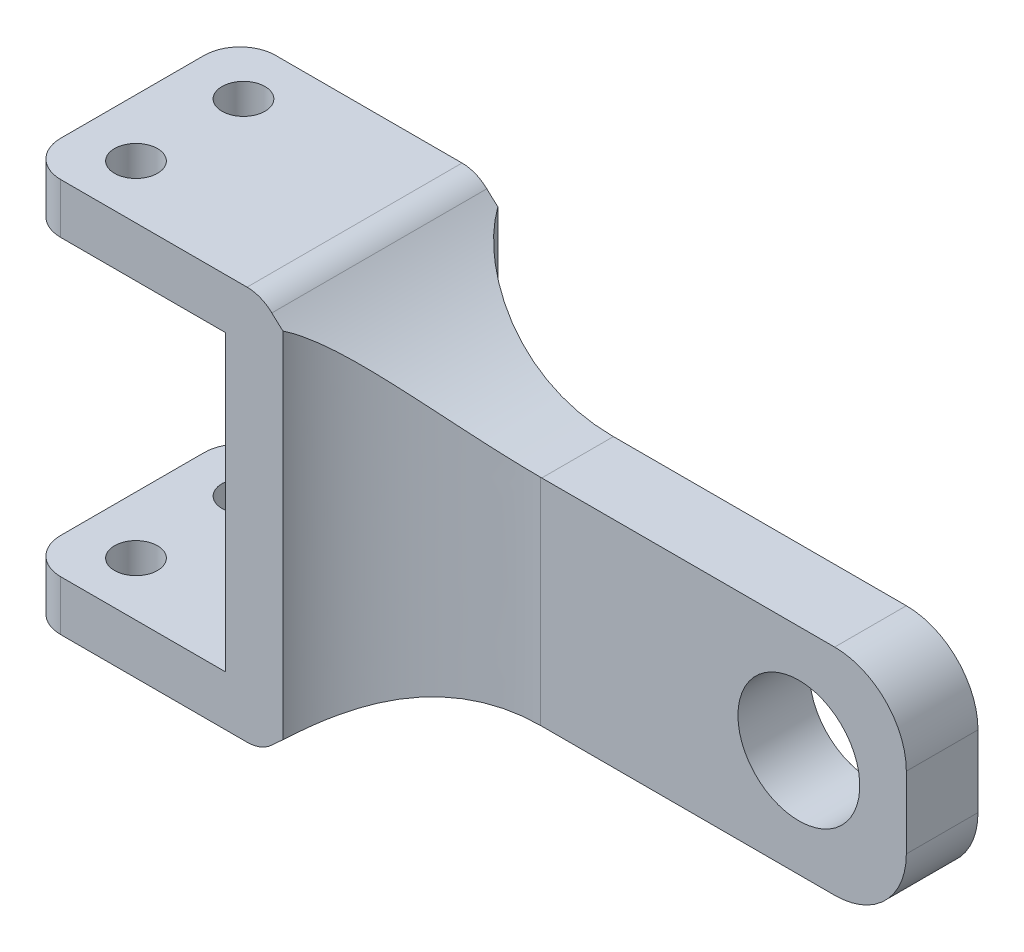
from build123d import *
from build123d.topology import SkipClean

# Parameters (mm, degrees)
SKETCH_1_W             = 85
SKETCH_1_H             = 30
EXTRUDE_1_DEPTH        = 10
EXTRUDE_2_DEPTH        = 10
EXTRUDE_2_DEPTH_BACK   = 20
SKETCH_3_W             = 8
SKETCH_3_H             = 30
SKETCH_2_R             = 8.5
CUT_EXTRUDE_1_DEPTH    = 10
SKETCH_5_W             = 8
SKETCH_5_H             = 30
EXTRUDE_3_DEPTH        = 12.5
SKETCH_6_W             = 30
SKETCH_6_H             = 7
EXTRUDE_4_DEPTH        = 28
CUT_EXTRUDE_2_REACH    = 99.115
SKETCH_7_R             = 3
FILLET_1_R             = 5
FILLET_1_OF_MIRROR_1_R = 5
FILLET_2_DEPTH         = 30
FILLET_3_DEPTH         = 30
FILLET_4_DEPTH         = 10
FILLET_START           = -9.709779072
FILLET_4_2_DEPTH       = 49.419558144
FILLET_START_2         = -11
FILLET_4_3_DEPTH       = 32
FILLET_START_3         = -10
FILLET_4_4_DEPTH       = 30
FILLET_6_R             = 10


with BuildPart() as part:
    # 草图1 → 凸台-拉伸1 (new body)
    with BuildSketch(Plane.XY):
        with Locations((42.5, 15)):
            Rectangle(SKETCH_1_W, SKETCH_1_H)
    extrude(amount=EXTRUDE_1_DEPTH)

    # 草图2 → 切除-拉伸1 (cut)
    with BuildSketch(Plane(origin=(0, 0, 0), x_dir=(-1, 0, 0), z_dir=(0, 0, -1))):
        with Locations((-70, 15)):
            Circle(SKETCH_2_R)
    extrude(amount=-CUT_EXTRUDE_1_DEPTH, mode=Mode.SUBTRACT)



with BuildPart() as body_2:
    # 草图3 → 凸台-拉伸2 (new, two sides: drawn at the far end of the back side and taken through both)
    with BuildSketch(Plane.XY.offset(10).offset(-EXTRUDE_2_DEPTH_BACK)):
        with Locations((4, 15)):
            Rectangle(SKETCH_3_W, SKETCH_3_H)
    extrude(amount=EXTRUDE_2_DEPTH + EXTRUDE_2_DEPTH_BACK)


with BuildPart() as part_1:
    add(part.part)

    add(body_2.part)  # 凸台-拉伸3 merges body 2
    # 草图5 → 凸台-拉伸3 (add)
    with BuildSketch(Plane(origin=(0, 30, 0), x_dir=(1, 0, 0), z_dir=(0, 1, 0))):
        with Locations((4, -5)):
            Rectangle(SKETCH_5_W, SKETCH_5_H)
    extrude_3 = extrude(amount=EXTRUDE_3_DEPTH)

    # 草图6 → 凸台-拉伸4 (add)
    with BuildSketch(Plane.ZY):
        with Locations((5, 39)):
            Rectangle(SKETCH_6_W, SKETCH_6_H)
    extrude_4 = extrude(amount=EXTRUDE_4_DEPTH)

    # 草图7 → 切除-拉伸2 (cut, up to next)
    with BuildSketch(Plane(origin=(0, 42.5, 0), x_dir=(1, 0, 0), z_dir=(0, 1, 0)), mode=Mode.PRIVATE) as cut_extrude_2_sk1:
        with Locations(Location((-20, 2.5, 0), (0, 0, 270))):
            Circle(SKETCH_7_R)
    cut_extrude_2_tool1 = extrude(cut_extrude_2_sk1.sketch, amount=-CUT_EXTRUDE_2_REACH, mode=Mode.PRIVATE) & part_1.part
    # 草图7 → 切除-拉伸2 (cut, up to next)
    with BuildSketch(Plane(origin=(0, 42.5, 0), x_dir=(1, 0, 0), z_dir=(0, 1, 0)), mode=Mode.PRIVATE) as cut_extrude_2_sk2:
        with Locations(Location((-20, -12.5, 0), (0, 0, 270))):
            Circle(SKETCH_7_R)
    cut_extrude_2_tool2 = extrude(cut_extrude_2_sk2.sketch, amount=-CUT_EXTRUDE_2_REACH, mode=Mode.PRIVATE) & part_1.part
    cut_extrude_2_1 = cut_extrude_2_tool1.solids().sort_by_distance((-20, 42.5, -2.5))[0]
    add(cut_extrude_2_1, mode=Mode.SUBTRACT)
    cut_extrude_2_2 = cut_extrude_2_tool2.solids().sort_by_distance((-20, 42.5, 12.5))[0]
    add(cut_extrude_2_2, mode=Mode.SUBTRACT)
    cut_extrude_2 = cut_extrude_2_1 + cut_extrude_2_2  # 切除-拉伸2 as one shape, for the pattern or mirror that repeats it

    # 圆角1
    fillet_1_edges = [part_1.edges().sort_by_distance(p)[0] for p in [
        (8, 42.5, 5),
        (-28, 39, -10),
        (-28, 39, 20),
    ]]
    fillet(fillet_1_edges, radius=FILLET_1_R)

    # 镜向1: 凸台-拉伸3, 凸台-拉伸4, 切除-拉伸2 across plane
    add(extrude_3.mirror(Plane.ZX.offset(15)))
    add(extrude_4.mirror(Plane.ZX.offset(15)))
    add(cut_extrude_2.mirror(Plane.ZX.offset(15)), mode=Mode.SUBTRACT)

    # 圆角1 of 镜向1
    fillet_1_of_mirror_1_edges = [part_1.edges().sort_by_distance(p)[0] for p in [
        (8, -12.5, 5),
        (-28, -9, -10),
        (-28, -9, 20),
    ]]
    fillet(fillet_1_of_mirror_1_edges, radius=FILLET_1_OF_MIRROR_1_R)

    # 圆角2: read off the stored shape, not the designer's step
    # 圆角2 outline → 圆角2 (add)
    with BuildSketch(Plane(origin=(0, 0, 0), x_dir=(1, 0, 0), z_dir=(0, 1, 0))):
        with BuildLine():
            add(Edge.make_bspline(
                [(33.980762114, -10), (13.773502692, -10), (8, -20)],
                knots=[0, 0, 0, 1, 1, 1], degree=2, weights=[1, 0.866025404, 1]))
            Line((33.980762114, -10), (8, -10))
            Line((8, -10), (8, -20))
        make_face()
    extrude(amount=FILLET_2_DEPTH)

    # 圆角3: read off the stored shape, not the designer's step
    # 圆角3 outline → 圆角3 (add)
    with BuildSketch(Plane(origin=(0, 0, 0), x_dir=(1, 0, 0), z_dir=(0, 1, 0))):
        with BuildLine():
            Line((8, 0), (33.980762114, 0))
            add(Edge.make_bspline(
                [(33.980762114, 0), (13.773502692, 0), (8, 10)],
                knots=[0, 0, 0, 1, 1, 1], degree=2, weights=[1, 0.866025404, 1]))
            Line((8, 10), (8, 0))
        make_face()
    extrude(amount=FILLET_3_DEPTH)

    # 圆角4: read off the stored shape, not the designer's step
    # 圆角4 outline → 圆角4 (add)
    with BuildSketch(Plane.XY):
        with BuildLine():
            ThreePointArc((6.458305444, -11.111111111), (19.217629145, -2.881570914), (34.124748995, 0))
            Line((34.124748995, 0), (8, 0))
            Line((8, 0), (8, -7.5))
            ThreePointArc((8, -7.5), (7.598452306, -9.463220922), (6.458305444, -11.111111111))
        make_face()
        with BuildLine():
            ThreePointArc((34.124748995, 30), (19.217629145, 32.881570914), (6.458305444, 41.111111111))
            ThreePointArc((6.458305444, 41.111111111), (7.598452306, 39.463220922), (8, 37.5))
            Line((8, 37.5), (8, 30))
            Line((8, 30), (34.124748995, 30))
        make_face()
    extrude(amount=FILLET_4_DEPTH)

    # Fillet 4 2 outline → Fillet 4 2 (add)
    with BuildSketch(Plane(origin=(0, 0, 0), x_dir=(1, 0, 0), z_dir=(0, 1, 0)).offset(FILLET_START)):
        with BuildLine():
            add(Edge.make_bspline(
                [(33.980762114, -10), (13.773502692, -10), (8, -20)],
                knots=[0, 0, 0, 1, 1, 1], degree=2, weights=[1, 0.866025404, 1]))
            Line((33.980762114, -10), (8, -10))
            Line((8, -10), (8, -20))
        make_face()
        with BuildLine():
            Line((8, 0), (33.980762114, 0))
            add(Edge.make_bspline(
                [(33.980762114, 0), (13.773502692, 0), (8, 10)],
                knots=[0, 0, 0, 1, 1, 1], degree=2, weights=[1, 0.866025404, 1]))
            Line((8, 10), (8, 0))
        make_face()
    extrude(amount=FILLET_4_2_DEPTH)

    # Fillet 4 3 outline → Fillet 4 3 (cut)
    with SkipClean():  # the faces are left unmerged after this step: merging them gives an invalid solid
        with BuildSketch(Plane.XY.offset(FILLET_START_2)):
            with BuildLine():
                Line((35, 0), (34.124748995, 0))
                ThreePointArc((34.124748995, 0), (20.189341563, -2.505941541), (7.99999995, -9.709779014))
                ThreePointArc((7.99999995, -9.709779014), (7.220027604, -10.400405968), (6.458305444, -11.111111111))
                Line((6.458305444, -11.111111111), (5, -12.507707754))
                Line((5, -12.507707754), (5, -13))
                Line((5, -13), (35, -13))
                Line((35, -13), (35, 0))
            make_face()
            with BuildLine():
                Line((34.124748995, 30), (35, 30))
                Line((35, 30), (35, 43))
                Line((35, 43), (5, 43))
                Line((5, 43), (5, 42.507707754))
                Line((5, 42.507707754), (6.458305444, 41.111111111))
                ThreePointArc((6.458305444, 41.111111111), (7.220027604, 40.400405968), (7.99999995, 39.709779014))
                ThreePointArc((7.99999995, 39.709779014), (20.189341563, 32.505941541), (34.124748995, 30))
            make_face()
        extrude(amount=FILLET_4_3_DEPTH, mode=Mode.SUBTRACT)
    add(part_1.part.scale(1), mode=Mode.REPLACE)  # the faces are merged on a copy

    # Fillet 4 4 outline → Fillet 4 4 (add)
    with BuildSketch(Plane.XY.offset(FILLET_START_3)):
        with BuildLine():
            ThreePointArc((6.458305444, -11.111111111), (7.220027604, -10.400405968), (7.99999995, -9.709779014))
            Line((7.99999995, -9.709779014), (8, -7.5))
            ThreePointArc((8, -7.5), (7.598452306, -9.463220922), (6.458305444, -11.111111111))
        make_face()
        with BuildLine():
            Line((8, 37.5), (7.99999995, 39.709779014))
            ThreePointArc((7.99999995, 39.709779014), (7.220027604, 40.400405968), (6.458305444, 41.111111111))
            ThreePointArc((6.458305444, 41.111111111), (7.598452306, 39.463220922), (8, 37.5))
        make_face()
    extrude(amount=FILLET_4_4_DEPTH)

    # 圆角6
    fillet_6_edges = [part_1.edges().sort_by_distance(p)[0] for p in [
        (85, 0, 5),
        (85, 30, 5),
    ]]
    fillet(fillet_6_edges, radius=FILLET_6_R)


solid = part_1.part
